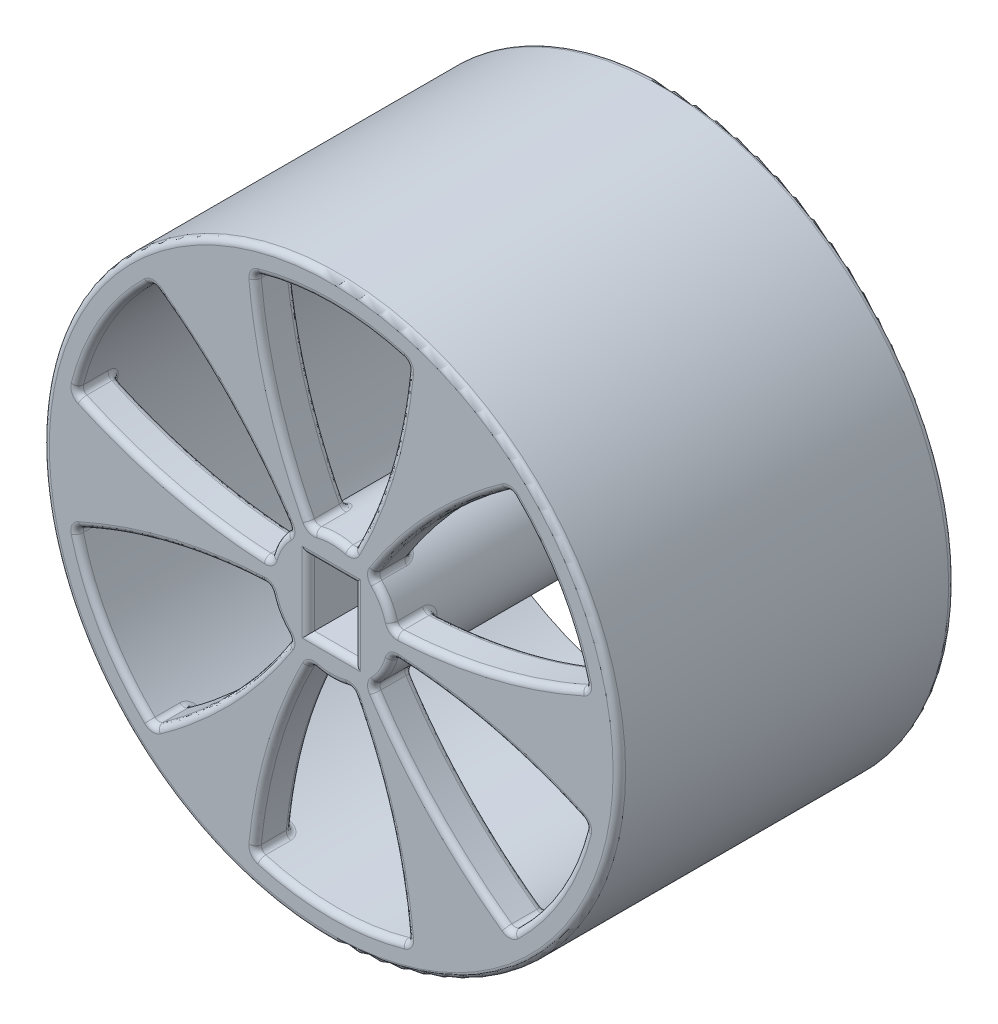
from build123d import *

# Parameters (mm, degrees)
SKETCH1_R           = 23.1
SKETCH1_R_2         = 21
BOSS_EXTRUDE1_DEPTH = 26.9
SKETCH2_R           = 5
SKETCH2_W           = 3.67
SKETCH2_H           = 5.403055556
BOSS_EXTRUDE2_DEPTH = 34
BOSS_EXTRUDE5_START = -3
BOSS_EXTRUDE5_DEPTH = 3
FILLET4_R           = 0.5
FILLET5_R           = 0.5
FILLET6_R           = 0.5
FILLET7_R           = 0.5
FILLET8_R           = 0.5


with BuildPart() as part:
    # Sketch1 → Boss-Extrude1 (new body)
    with BuildSketch(Plane.XY):
        Circle(SKETCH1_R)
        Circle(SKETCH1_R_2, mode=Mode.SUBTRACT)
    extrude(amount=BOSS_EXTRUDE1_DEPTH)



with BuildPart() as body_2:
    # Sketch2 → Boss-Extrude2 (new body)
    with BuildSketch(Plane.XY.offset(26.9)):
        Circle(SKETCH2_R)
        Rectangle(SKETCH2_W, SKETCH2_H, mode=Mode.SUBTRACT)
    extrude(amount=-BOSS_EXTRUDE2_DEPTH)


with BuildPart() as part_1:
    add(part.part)

    add(body_2.part)  # Boss-Extrude5 merges body 2
    # Sketch3 → Boss-Extrude5 (add)
    with BuildSketch(Plane.XY.offset(26.9).offset(BOSS_EXTRUDE5_START)):
        with BuildLine():
            Line((3.4175, 0.9), (3.4175, -0.9))
            add(Edge.make_bspline(
                [(3.4175, -0.9), (12.35691308, -0.9574243), (20.462427497, -4.721129202)],
                knots=[0, 0, 0, 1, 1, 1], degree=2))
            ThreePointArc((20.462427497, -4.721129202), (21, 0), (20.462427497, 4.721129202))
            add(Edge.make_bspline(
                [(3.4175, 0.9), (12.35471672, 0.966155701), (20.462427497, 4.721129202)],
                knots=[0, 0, 0, 1, 1, 1], degree=2))
        make_face()
        with BuildLine():
            ThreePointArc((6.142595925, -20.081546636), (10.5, -18.186533479), (14.319831572, -15.360417434))
            add(Edge.make_bspline(
                [(2.488172863, -2.509641817), (7.009065279, -10.221547416), (14.319831572, -15.360417434)],
                knots=[0, 0, 0, 1, 1, 1], degree=2))
            Line((2.488172863, -2.509641817), (0.929327137, -3.409641817))
            add(Edge.make_bspline(
                [(0.929327137, -3.409641817), (5.369384699, -11.174622061), (6.142595925, -20.081546636)],
                knots=[0, 0, 0, 1, 1, 1], degree=2))
        make_face()
        with BuildLine():
            add(Edge.make_bspline(
                [(2.488172863, 2.509641817), (6.992814233, 10.237334582), (14.319831572, 15.360417434)],
                knots=[0, 0, 0, 1, 1, 1], degree=2))
            ThreePointArc((14.319831572, 15.360417434), (10.5, 18.186533479), (6.142595925, 20.081546636))
            add(Edge.make_bspline(
                [(0.929327137, 3.409641817), (5.347587089, 11.180802297), (6.142595925, 20.081546636)],
                knots=[0, 0, 0, 1, 1, 1], degree=2))
            Line((0.929327137, 3.409641817), (2.488172863, 2.509641817))
        make_face()
        with BuildLine():
            ThreePointArc((-14.319831572, -15.360417434), (-10.5, -18.186533479), (-6.142595925, -20.081546636))
            add(Edge.make_bspline(
                [(-0.929327137, -3.409641817), (-5.347587089, -11.180802297), (-6.142595925, -20.081546636)],
                knots=[0, 0, 0, 1, 1, 1], degree=2))
            Line((-0.929327137, -3.409641817), (-2.488172863, -2.509641817))
            add(Edge.make_bspline(
                [(-2.488172863, -2.509641817), (-6.992814233, -10.237334582), (-14.319831572, -15.360417434)],
                knots=[0, 0, 0, 1, 1, 1], degree=2))
        make_face()
        with BuildLine():
            add(Edge.make_bspline(
                [(-0.929327137, 3.409641817), (-5.369384699, 11.174622061), (-6.142595925, 20.081546636)],
                knots=[0, 0, 0, 1, 1, 1], degree=2))
            ThreePointArc((-6.142595925, 20.081546636), (-10.5, 18.186533479), (-14.319831572, 15.360417434))
            add(Edge.make_bspline(
                [(-2.488172863, 2.509641817), (-7.009065279, 10.221547416), (-14.319831572, 15.360417434)],
                knots=[0, 0, 0, 1, 1, 1], degree=2))
            Line((-2.488172863, 2.509641817), (-0.929327137, 3.409641817))
        make_face()
        with BuildLine():
            ThreePointArc((-20.462427497, 4.721129202), (-21, 0), (-20.462427497, -4.721129202))
            add(Edge.make_bspline(
                [(-3.4175, -0.9), (-12.356652368, -0.95925488), (-20.462427497, -4.721129202)],
                knots=[0, 0, 0, 1, 1, 1], degree=2))
            Line((-3.4175, -0.9), (-3.4175, 0.9))
            add(Edge.make_bspline(
                [(-3.4175, 0.9), (-12.362198932, 0.937287479), (-20.462427497, 4.721129202)],
                knots=[0, 0, 0, 1, 1, 1], degree=2))
        make_face()
    extrude(amount=BOSS_EXTRUDE5_DEPTH)

    # Fillet4
    fillet4_edges = [part_1.edges().sort_by_distance(p)[0] for p in [
        (14.319831572, -15.360417434, 25.4),
        (6.142595925, -20.081546636, 25.4),
        (3.266408832, -3.785574375, 25.4),
        (1.64845269, -4.720445289, 25.4),
        (-6.142595925, -20.081546636, 25.4),
        (-14.319831572, -15.360417434, 25.4),
        (-1.64519916, -4.721580215, 25.4),
        (-3.263799193, -3.787824551, 25.4),
        (-4.912251883, 0.932620738, 25.4),
        (-20.462427497, 4.721129202, 25.4),
        (-20.462427497, -4.721129202, 25.4),
        (-4.911607992, -0.93600584, 25.4),
        (-1.64845269, 4.720445289, 25.4),
        (-6.142595925, 20.081546636, 25.4),
        (-14.319831572, 15.360417434, 25.4),
        (-3.266408832, 3.785574375, 25.4),
        (3.263799193, 3.787824551, 25.4),
        (14.319831572, 15.360417434, 25.4),
        (6.142595925, 20.081546636, 25.4),
        (1.64519916, 4.721580215, 25.4),
        (4.911661503, -0.935725001, 25.4),
        (20.462427497, -4.721129202, 25.4),
        (20.462427497, 4.721129202, 25.4),
        (4.911404954, 0.937070639, 25.4),
        (10.5, -18.186533479, 23.9),
        (8.217238241, -10.122750031, 23.9),
        (2.501491925, -4.329265313, 23.9),
        (4.668754664, -12.174630531, 23.9),
        (-10.5, -18.186533479, 23.9),
        (-4.657939563, -12.177712081, 23.9),
        (-2.498507778, -4.330988211, 23.9),
        (-8.209161989, -10.130575408, 23.9),
        (-12.877916653, 2.044055123, 23.9),
        (-21, 0, 23.9),
        (-12.875177804, -2.05496205, 23.9),
        (-4.999999703, -0.001722898, 23.9),
        (-4.668754664, 12.174630531, 23.9),
        (-10.5, 18.186533479, 23.9),
        (-8.217238241, 10.122750031, 23.9),
        (-2.501491925, 4.329265313, 23.9),
        (8.209161989, 10.130575408, 23.9),
        (10.5, 18.186533479, 23.9),
        (4.657939563, 12.177712081, 23.9),
        (2.498507778, 4.330988211, 23.9),
        (12.875399533, -2.054075953, 23.9),
        (20.865174064, 2.375818024, 23.9),
        (12.874311847, 2.058410358, 23.9),
        (4.977801963, 0.470624708, 23.9),
    ]]
    fillet(fillet4_edges, radius=FILLET4_R)

    # Fillet5
    fillet5_edges = [part_1.edges().sort_by_distance(p)[0] for p in [
        (-5, 0, -7.1),
    ]]
    fillet(fillet5_edges, radius=FILLET5_R)

    # Fillet6
    fillet6_edges = [part_1.edges().sort_by_distance(p)[0] for p in [
        (-23.1, 0, 26.9),
        (-20.330146433, -4.786821352, 26.9),
        (-18.186270883, -10.500454817, 26.9),
        (-14.310434997, -15.213682542, 26.9),
        (-8.210927709, -10.132422224, 26.9),
        (-3.411603931, -3.817476975, 26.9),
        (-4.329134605, -2.501718123, 26.9),
        (-5.011244747, -1.049599324, 26.9),
        (-12.877420153, -2.055508723, 26.9),
        (-14.310582111, 15.213012598, 26.9),
        (-18.186796065, 10.499545176, 26.9),
        (-20.330653065, 4.786358975, 26.9),
        (-12.880398903, 2.044660873, 26.9),
        (-5.011834004, 1.045797185, 26.9),
        (-4.331118751, 2.498281483, 26.9),
        (-3.414602052, 3.815065594, 26.9),
        (-8.218832848, 10.124418626, 26.9),
        (6.019564322, 19.99983395, 26.9),
        (-0.000525182, 20.999999993, 26.9),
        (-6.020218068, 20.000041517, 26.9),
        (-4.669471193, 12.177083097, 26.9),
        (-1.600230073, 4.86327416, 26.9),
        (-0.001984145, 4.999999606, 26.9),
        (1.596642696, 4.864664917, 26.9),
        (4.658587305, 12.179927349, 26.9),
        (20.329985176, 4.786968887, 26.9),
        (18.186187297, 10.500599584, 26.9),
        (14.310434997, 15.213682542, 26.9),
        (8.210927709, 10.132422224, 26.9),
        (3.411603931, 3.817476975, 26.9),
        (4.328822145, 2.502258747, 26.9),
        (5.011058904, 1.050795731, 26.9),
        (12.876477231, 2.058938109, 26.9),
        (-6.019564322, -19.99983395, 26.9),
        (0.000525182, -20.999999993, 26.9),
        (6.020218068, -20.000041517, 26.9),
        (4.669471193, -12.177083097, 26.9),
        (1.600230073, -4.86327416, 26.9),
        (0.001984145, -4.999999606, 26.9),
        (-1.596642696, -4.864664917, 26.9),
        (-4.658587305, -12.179927349, 26.9),
        (0, 2.701527778, 26.9),
        (-1.835, 0, 26.9),
        (0, -2.701527778, 26.9),
        (1.835, 0, 26.9),
        (14.310582111, -15.213012598, 26.9),
        (18.18655441, -10.499963746, 26.9),
        (20.330186843, -4.786784489, 26.9),
        (12.877660437, -2.054627199, 26.9),
        (5.011293881, -1.049284048, 26.9),
        (4.330209246, -2.499857574, 26.9),
        (3.414602052, -3.815065594, 26.9),
        (8.218832848, -10.124418626, 26.9),
    ]]
    fillet(fillet6_edges, radius=FILLET6_R)

    # Fillet7
    fillet7_edges = [part_1.edges().sort_by_distance(p)[0] for p in [
        (-23.1, 0, 0),
    ]]
    fillet(fillet7_edges, radius=FILLET7_R)

    # Fillet8
    fillet8_edges = [part_1.edges().sort_by_distance(p)[0] for p in [
        (-1.835, 0, -7.1),
        (0, 2.701527778, -7.1),
        (1.835, 0, -7.1),
        (0, -2.701527778, -7.1),
    ]]
    fillet(fillet8_edges, radius=FILLET8_R)


solid = part_1.part
